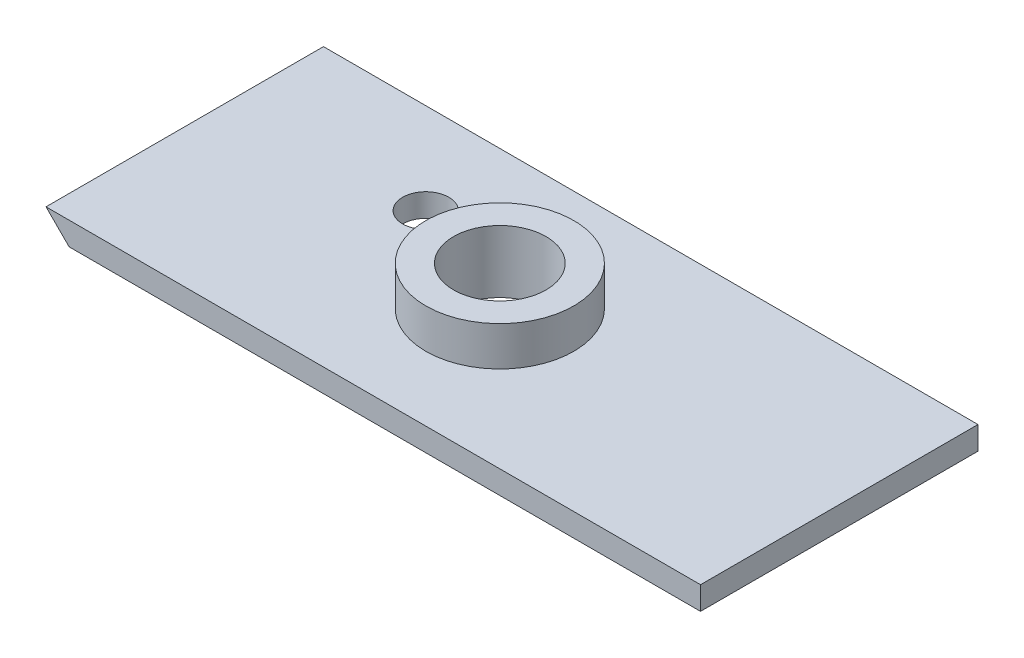
from build123d import *

# Parameters (mm, degrees)
SKETCH_2_W          = 30
SKETCH_2_H          = 12
SKETCH_2_R          = 2
EXTRUDE_1_DEPTH     = 1
SKETCH_3_R          = 3.2
SKETCH_3_R_2        = 2
EXTRUDE_2_DEPTH     = 1.7
SKETCH_4_R          = 1
CUT_EXTRUDE_1_DEPTH = 5
EXTRUDE_3_DEPTH     = 12
SKETCH_6_W          = 2
SKETCH_6_H          = 12
CUT_EXTRUDE_2_DEPTH = 1
CUT_EXTRUDE_3_DEPTH = 12


with BuildPart() as part:
    # 草图2 → 凸台-拉伸1 (new body)
    with BuildSketch(Plane(origin=(0, 0, 0), x_dir=(1, 0, 0), z_dir=(0, 1, 0))):
        with Locations((-3.527606217, -1.94741871)):
            Rectangle(SKETCH_2_W, SKETCH_2_H)
        with Locations((-5.207606217, -1.94741871)):
            Circle(SKETCH_2_R, mode=Mode.SUBTRACT)
    extrude(amount=EXTRUDE_1_DEPTH)

    # 草图3 → 凸台-拉伸2 (add)
    with BuildSketch(Plane(origin=(0, 1, 0), x_dir=(1, 0, 0), z_dir=(0, 1, 0))):
        with Locations((-5.207606217, -1.94741871)):
            Circle(SKETCH_3_R)
        with Locations((-5.207606217, -1.94741871)):
            Circle(SKETCH_3_R_2, mode=Mode.SUBTRACT)
    extrude(amount=EXTRUDE_2_DEPTH)

    # 草图4 → 切除-拉伸1 (cut)
    with BuildSketch(Plane.XZ):
        with Locations((-10.481209657, -0.12271673)):
            Circle(SKETCH_4_R)
    extrude(amount=-CUT_EXTRUDE_1_DEPTH, mode=Mode.SUBTRACT)

    # 草图5 → 凸台-拉伸3 (add)
    with BuildSketch(Plane(origin=(0, 0, -4.05258129), x_dir=(-1, 0, 0), z_dir=(0, 0, -1))):
        Polygon((18.527606217, 1), (18.527606217, 0), (19.527606217, 1), align=None)
    extrude(amount=-EXTRUDE_3_DEPTH)

    # 草图6 → 切除-拉伸2 (cut)
    with BuildSketch(Plane.XZ):
        with Locations((10.472393783, 1.94741871)):
            Rectangle(SKETCH_6_W, SKETCH_6_H)
    extrude(amount=-CUT_EXTRUDE_2_DEPTH, mode=Mode.SUBTRACT)

    # 草图7 → 切除-拉伸3 (cut)
    with BuildSketch(Plane(origin=(0, 0, -4.05258129), x_dir=(-1, 0, 0), z_dir=(0, 0, -1))):
        Polygon((19.527606217, 1), (18.527606217, 0), (17.834641572, 0), (18.834641572, 1), align=None)
    extrude(amount=-CUT_EXTRUDE_3_DEPTH, mode=Mode.SUBTRACT)


solid = part.part
